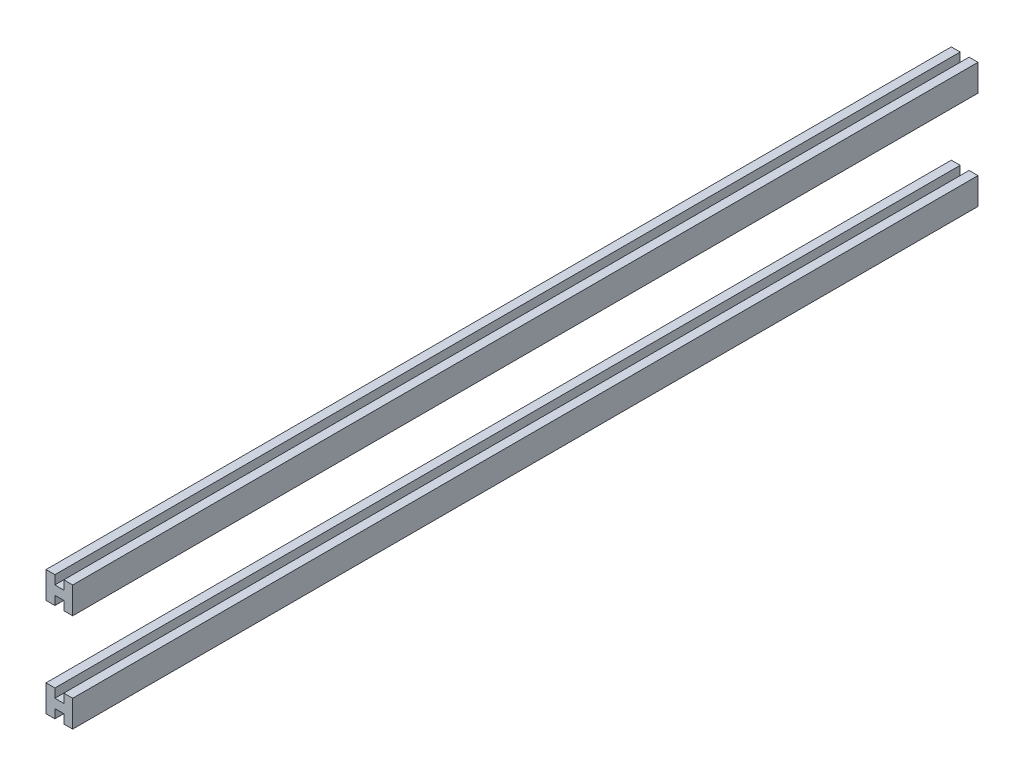
from build123d import *

# Parameters (mm, degrees)
BOSS_EXTRUDE3_DEPTH   = 2578.1
BOSS_EXTRUDE3_2_DEPTH = 2578.1


with BuildPart() as part:
    # Sketch1 → Boss-Extrude3 (new body)
    with BuildSketch(Plane.XY):
        Polygon((394.183100921, -272.194404357), (419.4943028, -272.194404357), (419.4943028, -195.994404357), (394.183100921, -195.994404357), (394.183100921, -221.374307502), (368.783100921, -221.374307502), (368.783100921, -195.994404357), (343.471899041, -195.994404357), (343.471899041, -272.194404357), (368.783100921, -272.194404357), (368.783100921, -246.814501211), (394.183100921, -246.814501211), align=None)
    extrude(amount=BOSS_EXTRUDE3_DEPTH)


with BuildPart() as body_2:
    # Sketch1 → Boss-Extrude3 2 (new body)
    with BuildSketch(Plane.XY):
        Polygon((368.783100921, 58.025692498), (368.783100921, 83.405595643), (343.471899041, 83.405595643), (343.471899041, 7.205595643), (368.783100921, 7.205595643), (368.783100921, 32.585498789), (394.183100921, 32.585498789), (394.183100921, 7.205595643), (419.4943028, 7.205595643), (419.4943028, 83.405595643), (394.183100921, 83.405595643), (394.183100921, 58.025692498), align=None)
    extrude(amount=BOSS_EXTRUDE3_2_DEPTH)


solid = Compound([part.part, body_2.part])
